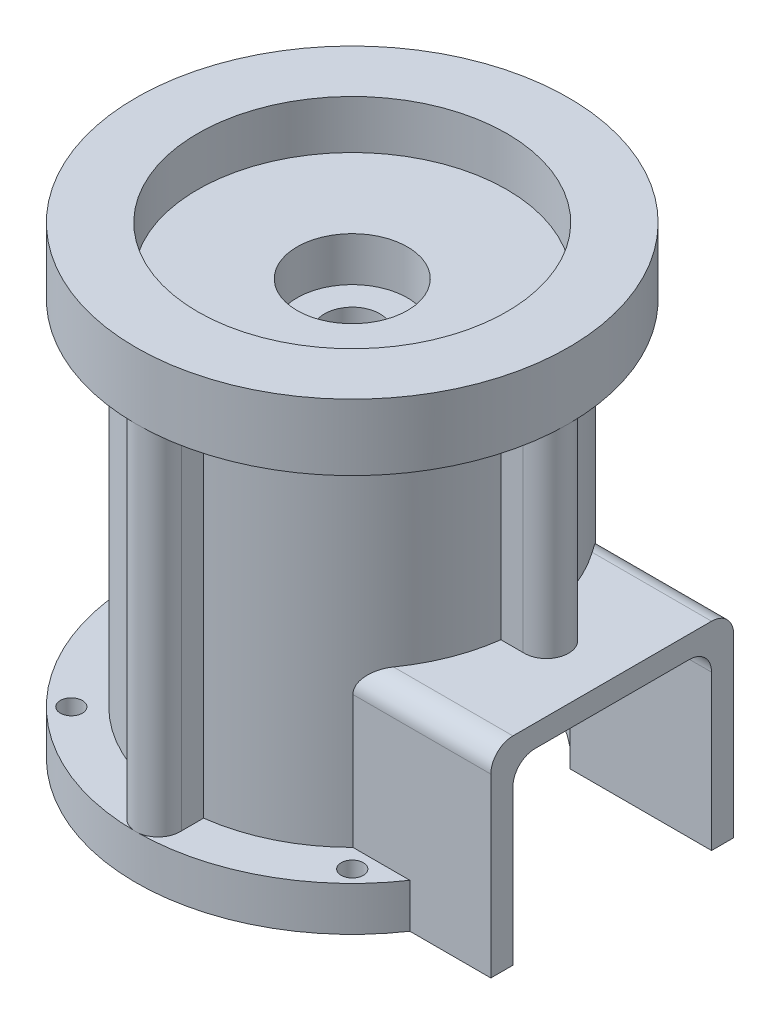
from build123d import *

# Parameters (mm, degrees)
SKETCH1_R               = 98
SKETCH1_R_2             = 78
BOSS_EXTRUDE1_DEPTH     = 20
SKETCH1_3_R             = 78
BOSS_EXTRUDE2_DEPTH     = 210
BOSS_EXTRUDE3_DEPTH     = 160
CIRPATTERN1_COUNT       = 4
BOSS_EXTRUDE4_START     = -30
SKETCH3_R               = 98
SKETCH3_R_2             = 78
BOSS_EXTRUDE4_DEPTH     = 30
SKETCH4_R               = 70
CUT_EXTRUDE1_DEPTH      = 22
SKETCH5_R               = 25
CUT_EXTRUDE2_DEPTH      = 20
CUT_EXTRUDE3_START      = -188
CUT_EXTRUDE3_OUTLINE_R  = 70
CUT_EXTRUDE3_DEPTH      = 153
SKETCH7_R               = 12.5
CUT_EXTRUDE4_DEPTH      = 218.788888605
BOSS_EXTRUDE6_DEPTH     = 90
FILLET1_R               = 10
CUT_EXTRUDE5_REACH      = 318.655
CUT_EXTRUDE5_END_RADIUS = 70
SKETCH12_R              = 5
CUT_EXTRUDE6_DEPTH      = 20


# Read off the part's stored shape, not the designer's step: Cut-Extrude3
with BuildPart() as part:
    # Sketch1 → Boss-Extrude1 (new body)
    # profile 1 of 2: a face of its own
    with BuildSketch(Plane(origin=(0, 0, 0), x_dir=(1, 0, 0), z_dir=(0, 1, 0))):
        with Locations(Location((0, 0, 0), (0, 0, 270))):
            Circle(SKETCH1_R)
        Circle(SKETCH1_R_2, mode=Mode.SUBTRACT)
    # profile 2 of 2: a face of its own
    with BuildSketch(Plane(origin=(0, 0, 0), x_dir=(1, 0, 0), z_dir=(0, 1, 0))):
        Circle(SKETCH1_R_2)
    extrude(amount=BOSS_EXTRUDE1_DEPTH)

    # Sketch1<3> → Boss-Extrude2 (add)
    with BuildSketch(Plane(origin=(0, 0, 0), x_dir=(1, 0, 0), z_dir=(0, 1, 0))):
        with Locations(Location((0, 0, 0), (0, 0, 270))):
            Circle(SKETCH1_3_R)
    extrude(amount=BOSS_EXTRUDE2_DEPTH)

    # Sketch2 → Boss-Extrude3 (add)
    with BuildSketch(Plane(origin=(0, 20, 0), x_dir=(1, 0, 0), z_dir=(0, 1, 0))):
        with BuildLine():
            ThreePointArc((9.983845423, -87.431818182), (6.867247692, -80.730824728), (-9e-09, -78))
            Line((0, -78), (0, -88))
            ThreePointArc((0, -88), (5, -87.857839718), (9.983845423, -87.431818182))
        make_face()
        with BuildLine():
            Line((0, -88), (0, -78))
            ThreePointArc((-9e-09, -78), (-6.867247699, -80.730824734), (-9.983845423, -87.431818182))
            ThreePointArc((-9.983845423, -87.431818182), (-5, -87.857839718), (0, -88))
        make_face()
        with BuildLine():
            ThreePointArc((9.983845423, -87.431818182), (5, -87.857839718), (0, -88))
            Line((0, -88), (0, -98))
            ThreePointArc((0, -98), (7.071067812, -95.071067812), (10, -88))
            ThreePointArc((10, -88), (9.99596054, -87.715794287), (9.983845423, -87.431818182))
        make_face()
        with BuildLine():
            Line((0, -98), (0, -88))
            ThreePointArc((0, -88), (-5, -87.857839718), (-9.983845423, -87.431818182))
            ThreePointArc((-9.983845423, -87.431818182), (-9.99596054, -87.715794287), (-10, -88))
            ThreePointArc((-10, -88), (-7.071067812, -95.071067812), (0, -98))
        make_face()
        with BuildLine():
            ThreePointArc((-9.983845423, -87.431818182), (-6.867247699, -80.730824734), (-9e-09, -78))
            ThreePointArc((-9e-09, -78), (-5.010347447, -77.838913266), (-10, -77.356318423))
            Line((-10, -77.356318423), (-10, -87.429971978))
            ThreePointArc((-10, -87.429971978), (-9.991922754, -87.430895453), (-9.983845423, -87.431818182))
        make_face()
        with BuildLine():
            ThreePointArc((10, -77.356318423), (5.010347438, -77.838913267), (-9e-09, -78))
            ThreePointArc((-9e-09, -78), (6.867247692, -80.730824728), (9.983845423, -87.431818182))
            ThreePointArc((9.983845423, -87.431818182), (9.991922754, -87.430895453), (10, -87.429971978))
            Line((10, -87.429971978), (10, -77.356318423))
        make_face()
    boss_extrude3 = extrude(amount=BOSS_EXTRUDE3_DEPTH)

    # CirPattern1: Boss-Extrude3 ×4 about axis
    cirpattern1_axis = Axis((0, 0, 0), (0, 1, 0))
    for i in range(1, CIRPATTERN1_COUNT):
        add(boss_extrude3.rotate(cirpattern1_axis, i * 360 / CIRPATTERN1_COUNT))

    # Sketch3 → Boss-Extrude4 (add)
    with BuildSketch(Plane(origin=(0, 210, 0), x_dir=(1, 0, 0), z_dir=(0, 1, 0)).offset(BOSS_EXTRUDE4_START)):
        with Locations(Location((0, 0, 0), (0, 0, 270))):
            Circle(SKETCH3_R)
        Circle(SKETCH3_R_2, mode=Mode.SUBTRACT)
    extrude(amount=BOSS_EXTRUDE4_DEPTH)

    # Sketch4 → Cut-Extrude1 (cut)
    with BuildSketch(Plane(origin=(0, 210, 0), x_dir=(1, 0, 0), z_dir=(0, 1, 0))):
        with Locations(Location((0, 0, 0), (0, 0, 270))):
            Circle(SKETCH4_R)
    extrude(amount=-CUT_EXTRUDE1_DEPTH, mode=Mode.SUBTRACT)

    # Sketch5 → Cut-Extrude2 (cut)
    with BuildSketch(Plane(origin=(0, 188, 0), x_dir=(1, 0, 0), z_dir=(0, 1, 0))):
        with Locations(Location((0, 0, 0), (0, 0, 270))):
            Circle(SKETCH5_R)
    extrude(amount=-CUT_EXTRUDE2_DEPTH, mode=Mode.SUBTRACT)

    # Cut-Extrude3 outline → Cut-Extrude3 (cut)
    with BuildSketch(Plane(origin=(0, 188, 0), x_dir=(1, 0, 0), z_dir=(0, 1, 0)).offset(CUT_EXTRUDE3_START)):
        Circle(CUT_EXTRUDE3_OUTLINE_R)
    extrude(amount=CUT_EXTRUDE3_DEPTH, mode=Mode.SUBTRACT)

    # Sketch7 → Cut-Extrude4 (cut, through all)
    with BuildSketch(Plane(origin=(0, 168, 0), x_dir=(1, 0, 0), z_dir=(0, 1, 0))):
        with Locations(Location((0, 0, 0), (0, 0, 270))):
            Circle(SKETCH7_R)
    extrude(amount=-CUT_EXTRUDE4_DEPTH, mode=Mode.SUBTRACT)

    # Sketch10 → Boss-Extrude6 (add)
    with BuildSketch(Plane.XZ):
        with BuildLine():
            Line((117.792189894, 0), (98, 0))
            ThreePointArc((98, 0), (93.68265963, -28.767330162), (81.111035008, -55))
            Line((81.111035008, -55), (117.792189894, -55))
            Line((117.792189894, -55), (117.792189894, 0))
        make_face()
        with BuildLine():
            ThreePointArc((81.111035008, -55), (93.68265963, -28.767330162), (98, 0))
            ThreePointArc((98, 0), (94.867247695, -7.269175269), (87.431818182, -9.983845423))
            Line((87.431818182, -9.983845423), (87.429971978, -10))
            Line((87.429971978, -10), (77.356318423, -10))
            ThreePointArc((77.356318423, -10), (70.04441747, -34.318793412), (55.308227236, -55))
            Line((55.308227236, -55), (81.111035008, -55))
        make_face()
    boss_extrude6 = extrude(amount=-BOSS_EXTRUDE6_DEPTH)

    # Mirror1: Boss-Extrude6 across plane
    add(boss_extrude6.mirror(Plane.XY))

    # Fillet1
    fillet1_edges = [part.edges().sort_by_distance(p)[0] for p in [
        (86.550208565, 90, -55),
        (86.550208565, 90, 55),
    ]]
    fillet(fillet1_edges, radius=FILLET1_R)

    # Cut-Extrude5: up to this cylinder (the profile starts outside it)
    cut_extrude5_end = Plane(origin=(0, 39.773519, 0), z_dir=(0, 1, 0)) * Cylinder(CUT_EXTRUDE5_END_RADIUS, 778.31, mode=Mode.PRIVATE)
    # Sketch11 → Cut-Extrude5 (cut, up to the surface)
    with BuildSketch(Plane(origin=(117.792189894, 0, 0), x_dir=(0, 0, -1), z_dir=(1, 0, 0)), mode=Mode.PRIVATE) as cut_extrude5_sk1:
        with BuildLine():
            Line((-45, 0), (45, 0))
            Line((45, 0), (45, 70))
            ThreePointArc((45, 70), (42.071067812, 77.071067812), (35, 80))
            Line((35, 80), (-35, 80))
            ThreePointArc((-35, 80), (-42.071067812, 77.071067812), (-45, 70))
            Line((-45, 70), (-45, 0))
        make_face()
    cut_extrude5_tool1 = extrude(cut_extrude5_sk1.sketch, amount=-CUT_EXTRUDE5_REACH, mode=Mode.PRIVATE) - cut_extrude5_end
    add(cut_extrude5_tool1.solids().sort_by_distance((117.79219, 39.773519, 0))[0], mode=Mode.SUBTRACT)

    # Sketch12 → Cut-Extrude6 (cut)
    with BuildSketch(Plane.XZ):
        with Locations(Location((-63.639610307, 63.639610307, 0), (0, 0, 270))):
            Circle(SKETCH12_R)
        with Locations(Location((63.639610307, 63.639610307, 0), (0, 0, 270))):
            Circle(SKETCH12_R)
        with Locations(Location((63.639610307, -63.639610307, 0), (0, 0, 270))):
            Circle(SKETCH12_R)
        with Locations(Location((-63.639610307, -63.639610307, 0), (0, 0, 270))):
            Circle(SKETCH12_R)
    extrude(amount=-CUT_EXTRUDE6_DEPTH, mode=Mode.SUBTRACT)


solid = part.part
